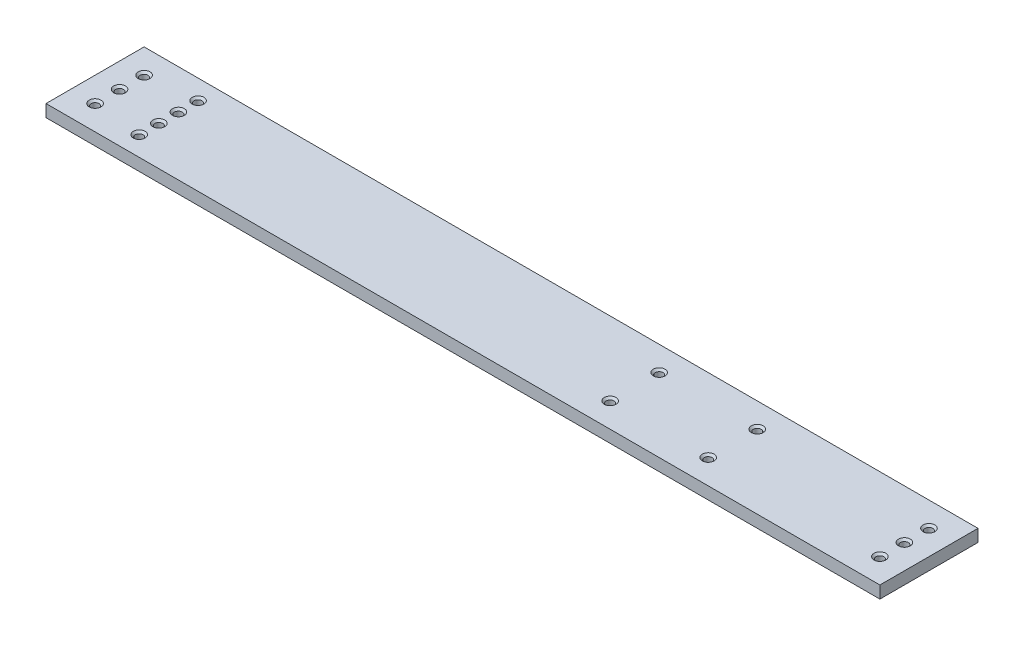
from build123d import *

# Parameters (mm, degrees)
SKETCH1_W                        = 431.8
SKETCH1_H                        = 50.8
BOSS_EXTRUDE1_DEPTH              = 6.35
F_10_32_TAPPED_HOLE1_D           = 4.0386
F_10_32_TAPPED_HOLE1_CSINK_D     = 6.096
F_10_32_TAPPED_HOLE1_CSINK_ANGLE = 90


with BuildPart() as part:
    # Sketch1 → Boss-Extrude1 (new body)
    with BuildSketch(Plane(origin=(0, 0, 0), x_dir=(1, 0, 0), z_dir=(0, 1, 0))):
        Rectangle(SKETCH1_W, SKETCH1_H)
    extrude(amount=BOSS_EXTRUDE1_DEPTH)

    # #10-32 Tapped Hole1 (through all)
    with Locations(Plane(origin=(0, 6.35, 0), x_dir=(1, 0, 0), z_dir=(0, 1, 0))):
        with Locations((-203.2, 12.7), (-203.2, 0), (-203.2, -12.7), (203.2, 12.7), (203.2, 0), (203.2, -12.7), (63.5, 12.7), (114.3, 12.7), (63.5, -12.7), (114.3, -12.7), (-177.8, 15.24), (-177.8, 5.08), (-177.8, -15.24), (-177.8, -5.08)):
            CounterSinkHole(F_10_32_TAPPED_HOLE1_D / 2, F_10_32_TAPPED_HOLE1_CSINK_D / 2, counter_sink_angle=F_10_32_TAPPED_HOLE1_CSINK_ANGLE)


solid = part.part
